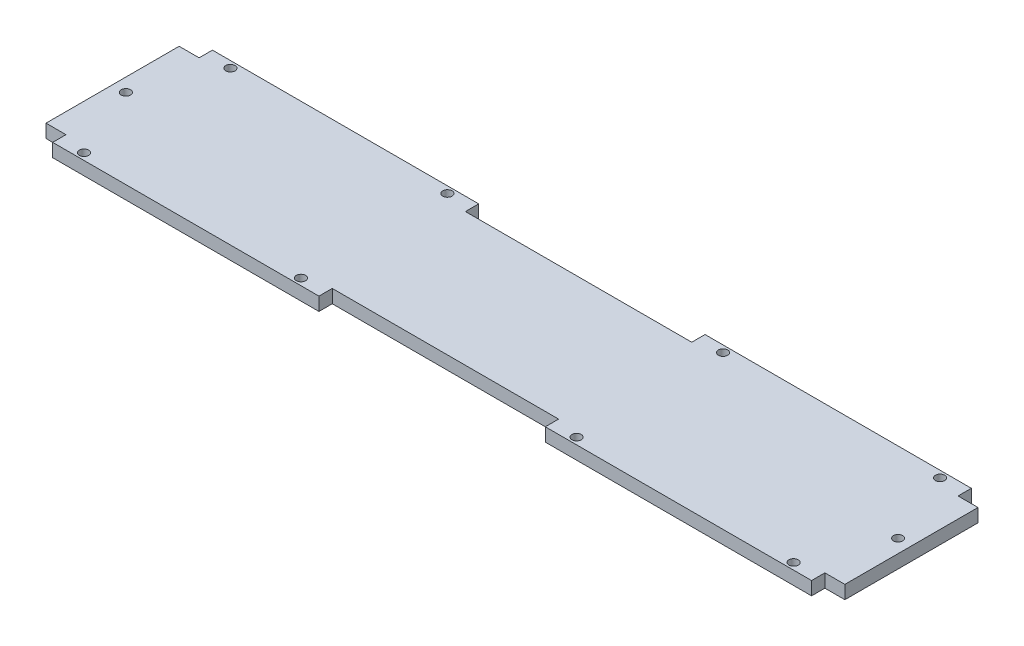
from build123d import *

# Parameters (mm, degrees)
SKETCH1_R           = 1.75
BOSS_EXTRUDE1_DEPTH = 5
SKETCH2_R           = 1.75
CUT_EXTRUDE1_DEPTH  = 10


with BuildPart() as part:
    # Sketch1 → Boss-Extrude1 (new body)
    with BuildSketch(Plane(origin=(0, 0, 0), x_dir=(1, 0, 0), z_dir=(0, 1, 0))):
        Polygon((-142.5, 0), (-142.5, -5), (-42.5, -5), (-42.5, 0), (42.5, 0), (42.5, -5), (142.5, -5), (142.5, 0), (150, 0), (150, 50), (142.5, 50), (142.5, 55), (42.5, 55), (42.5, 50), (-42.5, 50), (-42.5, 55), (-142.5, 55), (-142.5, 50), (-150, 50), (-150, 0), align=None)
        with Locations((-133.25, -2.5)):
            Circle(SKETCH1_R, mode=Mode.SUBTRACT)
        with Locations((-51.75, -2.5)):
            Circle(SKETCH1_R, mode=Mode.SUBTRACT)
        with Locations((-51.75, 52.5)):
            Circle(SKETCH1_R, mode=Mode.SUBTRACT)
        with Locations((-133.25, 52.5)):
            Circle(SKETCH1_R, mode=Mode.SUBTRACT)
        with Locations((133.25, 52.5)):
            Circle(SKETCH1_R, mode=Mode.SUBTRACT)
        with Locations((51.75, 52.5)):
            Circle(SKETCH1_R, mode=Mode.SUBTRACT)
        with Locations((133.25, -2.5)):
            Circle(SKETCH1_R, mode=Mode.SUBTRACT)
        with Locations((51.75, -2.5)):
            Circle(SKETCH1_R, mode=Mode.SUBTRACT)
    extrude(amount=BOSS_EXTRUDE1_DEPTH)

    # Sketch2 → Cut-Extrude1 (cut)
    with BuildSketch(Plane(origin=(0, 5, 0), x_dir=(1, 0, 0), z_dir=(0, 1, 0))):
        with Locations((-145, 25)):
            Circle(SKETCH2_R)
        with Locations((145, 25)):
            Circle(SKETCH2_R)
    extrude(amount=-CUT_EXTRUDE1_DEPTH, mode=Mode.SUBTRACT)


solid = part.part
